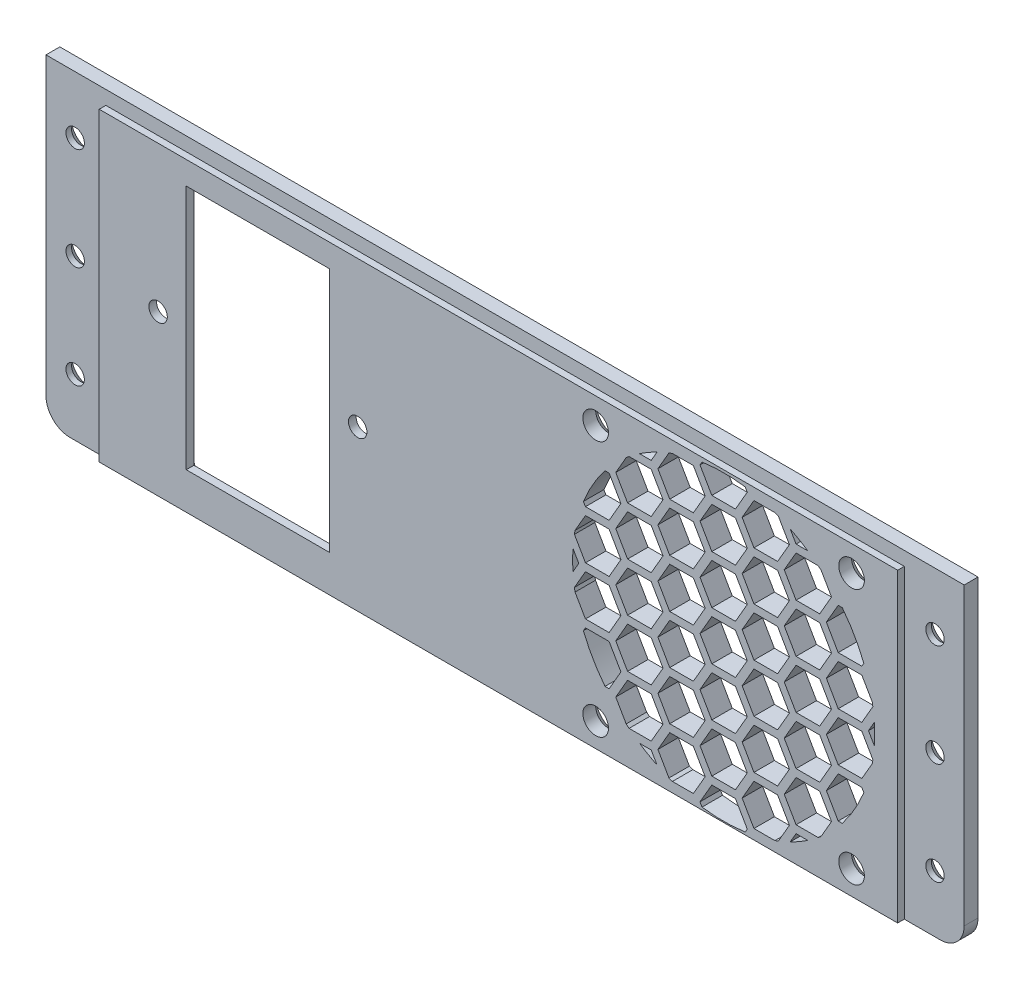
from build123d import *

# Parameters (mm, degrees)
SKETCH1_W                                       = 180
SKETCH1_H                                       = 63
BOSS_EXTRUDE1_DEPTH                             = 3
FILLET1_R                                       = 5
SKETCH2_W                                       = 156
SKETCH2_H                                       = 63
BOSS_EXTRUDE2_DEPTH                             = 4
CSK_FOR_M3_FLAT_HEAD_MACHINE_SCREW1_D           = 3.6
CSK_FOR_M3_FLAT_HEAD_MACHINE_SCREW1_DEPTH       = 8
CSK_FOR_M3_FLAT_HEAD_MACHINE_SCREW1_CSINK_D     = 6.8
CSK_FOR_M3_FLAT_HEAD_MACHINE_SCREW1_CSINK_ANGLE = 90
CSK_FOR_M3_FLAT_HEAD_MACHINE_SCREW1_TIP         = 1.081549114
SKETCH5_W                                       = 30
SKETCH5_H                                       = 60
CUT_EXTRUDE1_DEPTH                              = 2.5
SKETCH6_W                                       = 28
SKETCH6_H                                       = 48
CUT_EXTRUDE2_DEPTH                              = 96.45941546
FILLET2_R                                       = 2
M3_CLEARANCE_HOLE1_D                            = 3.6
M3_CLEARANCE_HOLE1_DEPTH                        = 8
M3_CLEARANCE_HOLE1_TIP                          = 1.081549114
CSK_FOR_M4_FLAT_HEAD_MACHINE_SCREW2_D           = 5
CSK_FOR_M4_FLAT_HEAD_MACHINE_SCREW2_CSINK_D     = 8
CSK_FOR_M4_FLAT_HEAD_MACHINE_SCREW2_CSINK_ANGLE = 90
SKETCH15_W                                      = 95
SKETCH15_H                                      = 63
CUT_EXTRUDE3_DEPTH                              = 3
SKETCH17_R                                      = 29.5
CUT_EXTRUDE7_DEPTH                              = 96.609884426
SKETCH18_W                                      = 180
SKETCH18_H                                      = 8
CUT_EXTRUDE8_DEPTH                              = 3
SKETCH20_W                                      = 30
SKETCH20_H                                      = 59
CUT_EXTRUDE9_DEPTH                              = 96.609884426
BOSS_EXTRUDE3_START                             = -4
BOSS_EXTRUDE3_DEPTH                             = 4
SKETCH20_2_W                                    = 30
SKETCH20_2_H                                    = 59
BOSS_EXTRUDE4_DEPTH                             = 4
SKETCH21_W                                      = 4
SKETCH21_H                                      = 60
CUT_EXTRUDE10_DEPTH                             = 3
SKETCH22_W                                      = 3
SKETCH22_H                                      = 60
CUT_EXTRUDE11_DEPTH                             = 116.595198862
CUT_EXTRUDE12_DEPTH                             = 0.3
CUT_EXTRUDE13_DEPTH                             = 96.437152095


# Read off the part's stored shape, not the designer's step: Boss-Extrude3
with BuildPart() as part:
    # Sketch1 → Boss-Extrude1 (new body)
    with BuildSketch(Plane.XY):
        Rectangle(SKETCH1_W, SKETCH1_H)
    extrude(amount=BOSS_EXTRUDE1_DEPTH)

    # Fillet1
    fillet1_edges = [part.edges().sort_by_distance(p)[0] for p in [
        (90, -31.5, 1.5),
        (-90, -31.5, 1.5),
    ]]
    fillet(fillet1_edges, radius=FILLET1_R)

    # Sketch2 → Boss-Extrude2 (add)
    with BuildSketch(Plane.XY.offset(3)):
        Rectangle(SKETCH2_W, SKETCH2_H)
    extrude(amount=BOSS_EXTRUDE2_DEPTH)

    # CSK for M3 Flat Head Machine Screw1
    with Locations(Plane(origin=(0, 0, 0), x_dir=(-1, 0, 0), z_dir=(0, 0, -1))):
        with Locations((-84, 20), (-84, -20), (84, 20), (84, -20), (-84, 0), (84, 0)):
            CounterSinkHole(CSK_FOR_M3_FLAT_HEAD_MACHINE_SCREW1_D / 2, CSK_FOR_M3_FLAT_HEAD_MACHINE_SCREW1_CSINK_D / 2, depth=CSK_FOR_M3_FLAT_HEAD_MACHINE_SCREW1_DEPTH, counter_sink_angle=CSK_FOR_M3_FLAT_HEAD_MACHINE_SCREW1_CSINK_ANGLE)
            with Locations((0, 0, -(CSK_FOR_M3_FLAT_HEAD_MACHINE_SCREW1_DEPTH + CSK_FOR_M3_FLAT_HEAD_MACHINE_SCREW1_TIP / 2))):  # 118° drill point
                Cone(0, CSK_FOR_M3_FLAT_HEAD_MACHINE_SCREW1_D / 2, CSK_FOR_M3_FLAT_HEAD_MACHINE_SCREW1_TIP, mode=Mode.SUBTRACT)

    # Sketch5 → Cut-Extrude1 (cut)
    with BuildSketch(Plane(origin=(0, 0, 0), x_dir=(-1, 0, 0), z_dir=(0, 0, -1))):
        Polygon((32, 30), (21, 0), (32, -30), align=None)
        with Locations((47, 0)):
            Rectangle(SKETCH5_W, SKETCH5_H)
        Polygon((62, -30), (73, 0), (62, 30), align=None)
    extrude(amount=-CUT_EXTRUDE1_DEPTH, mode=Mode.SUBTRACT)

    # Sketch6 → Cut-Extrude2 (cut, through all)
    with BuildSketch(Plane(origin=(0, 0, 2.5), x_dir=(-1, 0, 0), z_dir=(0, 0, -1))):
        with Locations((47, 0)):
            Rectangle(SKETCH6_W, SKETCH6_H)
    extrude(amount=-CUT_EXTRUDE2_DEPTH, mode=Mode.SUBTRACT)

    # Fillet2
    fillet2_edges = [part.edges().sort_by_distance(p)[0] for p in [
        (-21, 0, 1.25),
        (-32, 30, 1.25),
        (-62, 30, 1.25),
        (-73, 0, 1.25),
        (-62, -30, 1.25),
        (-32, -30, 1.25),
    ]]
    fillet(fillet2_edges, radius=FILLET2_R)

    # M3 Clearance Hole1
    with Locations(Plane(origin=(0, 0, 2.5), x_dir=(-1, 0, 0), z_dir=(0, 0, -1))):
        with Locations((27.5, 0), (66.5, 0)):
            Hole(M3_CLEARANCE_HOLE1_D / 2, depth=M3_CLEARANCE_HOLE1_DEPTH)
            with Locations((0, 0, -(M3_CLEARANCE_HOLE1_DEPTH + M3_CLEARANCE_HOLE1_TIP / 2))):  # 118° drill point
                Cone(0, M3_CLEARANCE_HOLE1_D / 2, M3_CLEARANCE_HOLE1_TIP, mode=Mode.SUBTRACT)

    # CSK for M4 Flat Head Machine Screw2 (through all)
    with Locations(Plane(origin=(0, 0, 0), x_dir=(-1, 0, 0), z_dir=(0, 0, -1))):
        with Locations((-19, 23.5), (-19, -26.5), (-69, -26.5), (-69, 23.5)):
            CounterSinkHole(CSK_FOR_M4_FLAT_HEAD_MACHINE_SCREW2_D / 2, CSK_FOR_M4_FLAT_HEAD_MACHINE_SCREW2_CSINK_D / 2, counter_sink_angle=CSK_FOR_M4_FLAT_HEAD_MACHINE_SCREW2_CSINK_ANGLE)

    # Sketch15 → Cut-Extrude3 (cut)
    with BuildSketch(Plane.XY.offset(7)):
        with Locations((26.5, 0)):
            Rectangle(SKETCH15_W, SKETCH15_H)
    extrude(amount=-CUT_EXTRUDE3_DEPTH, mode=Mode.SUBTRACT)

    # Sketch17 → Cut-Extrude7 (cut, through all)
    with BuildSketch(Plane(origin=(0, 0, 0), x_dir=(-1, 0, 0), z_dir=(0, 0, -1))):
        with Locations((-44, -1.5)):
            Circle(SKETCH17_R)
    extrude(amount=-CUT_EXTRUDE7_DEPTH, mode=Mode.SUBTRACT)

    # Sketch18 → Cut-Extrude8 (cut)
    with BuildSketch(Plane(origin=(0, 31.5, 0), x_dir=(1, 0, 0), z_dir=(0, 1, 0))):
        with Locations((0, -7)):
            Rectangle(SKETCH18_W, SKETCH18_H)
    extrude(amount=-CUT_EXTRUDE8_DEPTH, mode=Mode.SUBTRACT)

    # Sketch20 → Cut-Extrude9 (cut, through all)
    with BuildSketch(Plane(origin=(0, 0, 0), x_dir=(-1, 0, 0), z_dir=(0, 0, -1))):
        with Locations((5, -1.5)):
            Rectangle(SKETCH20_W, SKETCH20_H)
    extrude(amount=-CUT_EXTRUDE9_DEPTH, mode=Mode.SUBTRACT)

    # Boss-Extrude3 outline → Boss-Extrude3 (add)
    # profile 1 of 2: a face of its own
    with BuildSketch(Plane(origin=(0, 0, 0), x_dir=(-1, 0, 0), z_dir=(0, 0, -1)).offset(BOSS_EXTRUDE3_START)):
        Polygon((-10, 2.5), (-8.770598923, 2.5), (-6.461197846, -1.5), (-8.770598923, -5.5), (-10, -5.5), (-10, -7), (-8.770598923, -7), (-6.461197846, -11), (-8.770598923, -15), (-10, -15), (-10, -16.5), (-8.770598923, -16.5), (-6.461197846, -20.5), (-8.770598923, -24.5), (-10, -24.5), (-10, -26), (-8.770598923, -26), (-6.461197846, -30), (-7.038548116, -31), (1.338548116, -31), (0.761197846, -30), (3.070598923, -26), (7.689401077, -26), (9.998802154, -30), (9.421451884, -31), (17.798548116, -31), (17.221197846, -30), (19.530598923, -26), (20, -26), (20, -24.5), (19.530598923, -24.5), (17.221197846, -20.5), (19.530598923, -16.5), (20, -16.5), (20, -15), (19.530598923, -15), (17.221197846, -11), (19.530598923, -7), (20, -7), (20, -5.5), (19.530598923, -5.5), (17.221197846, -1.5), (19.530598923, 2.5), (20, 2.5), (20, 4), (19.530598923, 4), (17.221197846, 8), (19.530598923, 12), (20, 12), (20, 13.5), (19.530598923, 13.5), (17.221197846, 17.5), (19.530598923, 21.5), (20, 21.5), (20, 23), (19.530598923, 23), (17.221197846, 27), (17.798548116, 28), (9.421451884, 28), (9.998802154, 27), (7.689401077, 23), (3.070598923, 23), (0.761197846, 27), (1.338548116, 28), (-7.038548116, 28), (-6.461197846, 27), (-8.770598923, 23), (-10, 23), (-10, 21.5), (-8.770598923, 21.5), (-6.461197846, 17.5), (-8.770598923, 13.5), (-10, 13.5), (-10, 12), (-8.770598923, 12), (-6.461197846, 8), (-8.770598923, 4), (-10, 4), align=None)
        Polygon((-5.162159741, -21.25), (-0.543357587, -21.25), (1.766043489, -25.25), (-0.543357587, -29.25), (-5.162159741, -29.25), (-7.471560818, -25.25), align=None, mode=Mode.SUBTRACT)
        Polygon((11.297840259, -21.25), (15.916642413, -21.25), (18.226043489, -25.25), (15.916642413, -29.25), (11.297840259, -29.25), (8.988439182, -25.25), align=None, mode=Mode.SUBTRACT)
        Polygon((3.070598923, -16.5), (7.689401077, -16.5), (9.998802154, -20.5), (7.689401077, -24.5), (3.070598923, -24.5), (0.761197846, -20.5), align=None, mode=Mode.SUBTRACT)
        Polygon((-5.162159741, -11.75), (-0.543357587, -11.75), (1.766043489, -15.75), (-0.543357587, -19.75), (-5.162159741, -19.75), (-7.471560818, -15.75), align=None, mode=Mode.SUBTRACT)
        Polygon((3.070598923, -7), (7.689401077, -7), (9.998802154, -11), (7.689401077, -15), (3.070598923, -15), (0.761197846, -11), align=None, mode=Mode.SUBTRACT)
        Polygon((11.297840259, -11.75), (15.916642413, -11.75), (18.226043489, -15.75), (15.916642413, -19.75), (11.297840259, -19.75), (8.988439182, -15.75), align=None, mode=Mode.SUBTRACT)
        Polygon((-5.162159741, -2.25), (-0.543357587, -2.25), (1.766043489, -6.25), (-0.543357587, -10.25), (-5.162159741, -10.25), (-7.471560818, -6.25), align=None, mode=Mode.SUBTRACT)
        Polygon((11.297840259, -2.25), (15.916642413, -2.25), (18.226043489, -6.25), (15.916642413, -10.25), (11.297840259, -10.25), (8.988439182, -6.25), align=None, mode=Mode.SUBTRACT)
        Polygon((3.070598923, 2.5), (7.689401077, 2.5), (9.998802154, -1.5), (7.689401077, -5.5), (3.070598923, -5.5), (0.761197846, -1.5), align=None, mode=Mode.SUBTRACT)
        Polygon((-5.162159741, 7.25), (-0.543357587, 7.25), (1.766043489, 3.25), (-0.543357587, -0.75), (-5.162159741, -0.75), (-7.471560818, 3.25), align=None, mode=Mode.SUBTRACT)
        Polygon((11.297840259, 7.25), (15.916642413, 7.25), (18.226043489, 3.25), (15.916642413, -0.75), (11.297840259, -0.75), (8.988439182, 3.25), align=None, mode=Mode.SUBTRACT)
        Polygon((3.070598923, 12), (7.689401077, 12), (9.998802154, 8), (7.689401077, 4), (3.070598923, 4), (0.761197846, 8), align=None, mode=Mode.SUBTRACT)
        Polygon((-5.162159741, 16.75), (-0.543357587, 16.75), (1.766043489, 12.75), (-0.543357587, 8.75), (-5.162159741, 8.75), (-7.471560818, 12.75), align=None, mode=Mode.SUBTRACT)
        Polygon((11.297840259, 16.75), (15.916642413, 16.75), (18.226043489, 12.75), (15.916642413, 8.75), (11.297840259, 8.75), (8.988439182, 12.75), align=None, mode=Mode.SUBTRACT)
        Polygon((3.070598923, 21.5), (7.689401077, 21.5), (9.998802154, 17.5), (7.689401077, 13.5), (3.070598923, 13.5), (0.761197846, 17.5), align=None, mode=Mode.SUBTRACT)
        Polygon((-0.543357587, 18.25), (-5.162159741, 18.25), (-7.471560818, 22.25), (-5.162159741, 26.25), (-0.543357587, 26.25), (1.766043489, 22.25), align=None, mode=Mode.SUBTRACT)
        Polygon((15.916642413, 18.25), (11.297840259, 18.25), (8.988439182, 22.25), (11.297840259, 26.25), (15.916642413, 26.25), (18.226043489, 22.25), align=None, mode=Mode.SUBTRACT)
    # profile 2 of 2: a face of its own
    with BuildSketch(Plane(origin=(0, 0, 0), x_dir=(-1, 0, 0), z_dir=(0, 0, -1)).offset(BOSS_EXTRUDE3_START)):
        with BuildLine():
            Line((-71.002159741, 7.25), (-66.383357587, 7.25))
            Line((-66.383357587, 7.25), (-64.073956511, 3.25))
            Line((-64.073956511, 3.25), (-66.383357587, -0.75))
            Line((-66.383357587, -0.75), (-71.002159741, -0.75))
            Line((-71.002159741, -0.75), (-73.157384631, 2.982959011))
            ThreePointArc((-73.157384631, 2.982959011), (-73.323076078, 1.726020663), (-73.434607942, 0.46312387))
            Line((-73.434607942, 0.46312387), (-72.301197846, -1.5))
            Line((-72.301197846, -1.5), (-73.434607942, -3.46312387))
            ThreePointArc((-73.434607942, -3.46312387), (-73.323076078, -4.726020663), (-73.157384631, -5.982959011))
            Line((-73.157384631, -5.982959011), (-71.002159741, -2.25))
            Line((-71.002159741, -2.25), (-66.383357587, -2.25))
            Line((-66.383357587, -2.25), (-64.073956511, -6.25))
            Line((-64.073956511, -6.25), (-66.383357587, -10.25))
            Line((-66.383357587, -10.25), (-71.002159741, -10.25))
            Line((-71.002159741, -10.25), (-73.031899444, -6.734387708))
            ThreePointArc((-73.031899444, -6.734387708), (-72.358660898, -9.626275411), (-71.398128519, -12.435838042))
            Line((-71.398128519, -12.435838042), (-71.002159741, -11.75))
            Line((-71.002159741, -11.75), (-66.383357587, -11.75))
            Line((-66.383357587, -11.75), (-64.073956511, -15.75))
            Line((-64.073956511, -15.75), (-66.383357587, -19.75))
            Line((-66.383357587, -19.75), (-67.177305711, -19.75))
            ThreePointArc((-67.177305711, -19.75), (-65.216215637, -21.996882544), (-63.038286077, -24.034277517))
            Line((-63.038286077, -24.034277517), (-65.078802154, -20.5))
            Line((-65.078802154, -20.5), (-62.769401077, -16.5))
            Line((-62.769401077, -16.5), (-58.150598923, -16.5))
            Line((-58.150598923, -16.5), (-55.841197846, -20.5))
            Line((-55.841197846, -20.5), (-58.150598923, -24.5))
            Line((-58.150598923, -24.5), (-62.472953202, -24.5))
            ThreePointArc((-62.472953202, -24.5), (-61.468422871, -25.271920461), (-60.431676725, -26))
            Line((-60.431676725, -26), (-58.150598923, -26))
            Line((-58.150598923, -26), (-57.009485308, -27.976466759))
            ThreePointArc((-57.009485308, -27.976466759), (-55.860297918, -28.510800308), (-54.689221018, -28.995282396))
            Line((-54.689221018, -28.995282396), (-56.851560818, -25.25))
            Line((-56.851560818, -25.25), (-54.542159741, -21.25))
            Line((-54.542159741, -21.25), (-49.923357587, -21.25))
            Line((-49.923357587, -21.25), (-47.613956511, -25.25))
            Line((-47.613956511, -25.25), (-49.923357587, -29.25))
            Line((-49.923357587, -29.25), (-54.00937061, -29.25))
            ThreePointArc((-54.00937061, -29.25), (-51.149549143, -30.120516191), (-48.216310764, -30.697135537))
            Line((-48.216310764, -30.697135537), (-48.618802154, -30))
            Line((-48.618802154, -30), (-46.309401077, -26))
            Line((-46.309401077, -26), (-41.690598923, -26))
            Line((-41.690598923, -26), (-39.381197846, -30))
            Line((-39.381197846, -30), (-39.783689236, -30.697135537))
            ThreePointArc((-39.783689236, -30.697135537), (-36.850450857, -30.120516191), (-33.99062939, -29.25))
            Line((-33.99062939, -29.25), (-38.082159741, -29.25))
            Line((-38.082159741, -29.25), (-40.391560818, -25.25))
            Line((-40.391560818, -25.25), (-38.082159741, -21.25))
            Line((-38.082159741, -21.25), (-33.463357587, -21.25))
            Line((-33.463357587, -21.25), (-31.153956511, -25.25))
            Line((-31.153956511, -25.25), (-33.317892314, -28.998046756))
            ThreePointArc((-33.317892314, -28.998046756), (-32.143196001, -28.5123342), (-30.990514692, -27.976466759))
            Line((-30.990514692, -27.976466759), (-29.849401077, -26))
            Line((-29.849401077, -26), (-27.568323275, -26))
            ThreePointArc((-27.568323275, -26), (-26.531577129, -25.271920461), (-25.527046798, -24.5))
            Line((-25.527046798, -24.5), (-29.849401077, -24.5))
            Line((-29.849401077, -24.5), (-32.158802154, -20.5))
            Line((-32.158802154, -20.5), (-29.849401077, -16.5))
            Line((-29.849401077, -16.5), (-25.230598923, -16.5))
            Line((-25.230598923, -16.5), (-22.921197846, -20.5))
            Line((-22.921197846, -20.5), (-24.961713923, -24.034277517))
            ThreePointArc((-24.961713923, -24.034277517), (-22.783784363, -21.996882544), (-20.822694289, -19.75))
            Line((-20.822694289, -19.75), (-21.622159741, -19.75))
            Line((-21.622159741, -19.75), (-23.931560818, -15.75))
            Line((-23.931560818, -15.75), (-21.622159741, -11.75))
            Line((-21.622159741, -11.75), (-17.003357587, -11.75))
            Line((-17.003357587, -11.75), (-16.604127104, -12.44148748))
            ThreePointArc((-16.604127104, -12.44148748), (-15.640233737, -9.622416976), (-14.965600175, -6.720500629))
            Line((-14.965600175, -6.720500629), (-17.003357587, -10.25))
            Line((-17.003357587, -10.25), (-21.622159741, -10.25))
            Line((-21.622159741, -10.25), (-23.931560818, -6.25))
            Line((-23.931560818, -6.25), (-21.622159741, -2.25))
            Line((-21.622159741, -2.25), (-17.003357587, -2.25))
            Line((-17.003357587, -2.25), (-14.843776452, -5.99050425))
            ThreePointArc((-14.843776452, -5.99050425), (-14.677341584, -4.72981477), (-14.565392058, -3.46312387))
            Line((-14.565392058, -3.46312387), (-15.698802154, -1.5))
            Line((-15.698802154, -1.5), (-14.565392058, 0.46312387))
            ThreePointArc((-14.565392058, 0.46312387), (-14.677341584, 1.72981477), (-14.843776452, 2.99050425))
            Line((-14.843776452, 2.99050425), (-17.003357587, -0.75))
            Line((-17.003357587, -0.75), (-21.622159741, -0.75))
            Line((-21.622159741, -0.75), (-23.931560818, 3.25))
            Line((-23.931560818, 3.25), (-21.622159741, 7.25))
            Line((-21.622159741, 7.25), (-17.003357587, 7.25))
            Line((-17.003357587, 7.25), (-14.965600175, 3.720500629))
            ThreePointArc((-14.965600175, 3.720500629), (-15.640233737, 6.622416976), (-16.604127104, 9.44148748))
            Line((-16.604127104, 9.44148748), (-17.003357587, 8.75))
            Line((-17.003357587, 8.75), (-21.622159741, 8.75))
            Line((-21.622159741, 8.75), (-23.931560818, 12.75))
            Line((-23.931560818, 12.75), (-21.622159741, 16.75))
            Line((-21.622159741, 16.75), (-20.822694289, 16.75))
            ThreePointArc((-20.822694289, 16.75), (-22.783784363, 18.996882544), (-24.961713923, 21.034277517))
            Line((-24.961713923, 21.034277517), (-22.921197846, 17.5))
            Line((-22.921197846, 17.5), (-25.230598923, 13.5))
            Line((-25.230598923, 13.5), (-29.849401077, 13.5))
            Line((-29.849401077, 13.5), (-32.158802154, 17.5))
            Line((-32.158802154, 17.5), (-29.849401077, 21.5))
            Line((-29.849401077, 21.5), (-25.527046798, 21.5))
            ThreePointArc((-25.527046798, 21.5), (-26.531577129, 22.271920461), (-27.568323275, 23))
            Line((-27.568323275, 23), (-29.849401077, 23))
            Line((-29.849401077, 23), (-30.990514692, 24.976466759))
            ThreePointArc((-30.990514692, 24.976466759), (-32.143196001, 25.5123342), (-33.317892314, 25.998046756))
            Line((-33.317892314, 25.998046756), (-31.153956511, 22.25))
            Line((-31.153956511, 22.25), (-33.463357587, 18.25))
            Line((-33.463357587, 18.25), (-38.082159741, 18.25))
            Line((-38.082159741, 18.25), (-40.391560818, 22.25))
            Line((-40.391560818, 22.25), (-38.082159741, 26.25))
            Line((-38.082159741, 26.25), (-33.99062939, 26.25))
            ThreePointArc((-33.99062939, 26.25), (-36.850450857, 27.120516191), (-39.783689236, 27.697135537))
            Line((-39.783689236, 27.697135537), (-39.381197846, 27))
            Line((-39.381197846, 27), (-41.690598923, 23))
            Line((-41.690598923, 23), (-46.309401077, 23))
            Line((-46.309401077, 23), (-48.618802154, 27))
            Line((-48.618802154, 27), (-48.216310764, 27.697135537))
            ThreePointArc((-48.216310764, 27.697135537), (-51.149549143, 27.120516191), (-54.00937061, 26.25))
            Line((-54.00937061, 26.25), (-49.923357587, 26.25))
            Line((-49.923357587, 26.25), (-47.613956511, 22.25))
            Line((-47.613956511, 22.25), (-49.923357587, 18.25))
            Line((-49.923357587, 18.25), (-54.542159741, 18.25))
            Line((-54.542159741, 18.25), (-56.851560818, 22.25))
            Line((-56.851560818, 22.25), (-54.689221018, 25.995282396))
            ThreePointArc((-54.689221018, 25.995282396), (-55.860297918, 25.510800308), (-57.009485308, 24.976466759))
            Line((-57.009485308, 24.976466759), (-58.150598923, 23))
            Line((-58.150598923, 23), (-60.431676725, 23))
            ThreePointArc((-60.431676725, 23), (-61.468422871, 22.271920461), (-62.472953202, 21.5))
            Line((-62.472953202, 21.5), (-58.150598923, 21.5))
            Line((-58.150598923, 21.5), (-55.841197846, 17.5))
            Line((-55.841197846, 17.5), (-58.150598923, 13.5))
            Line((-58.150598923, 13.5), (-62.769401077, 13.5))
            Line((-62.769401077, 13.5), (-65.078802154, 17.5))
            Line((-65.078802154, 17.5), (-63.038286077, 21.034277517))
            ThreePointArc((-63.038286077, 21.034277517), (-65.216215637, 18.996882544), (-67.177305711, 16.75))
            Line((-67.177305711, 16.75), (-66.383357587, 16.75))
            Line((-66.383357587, 16.75), (-64.073956511, 12.75))
            Line((-64.073956511, 12.75), (-66.383357587, 8.75))
            Line((-66.383357587, 8.75), (-71.002159741, 8.75))
            Line((-71.002159741, 8.75), (-71.398128519, 9.435838042))
            ThreePointArc((-71.398128519, 9.435838042), (-72.358660898, 6.626275411), (-73.031899444, 3.734387708))
            Line((-73.031899444, 3.734387708), (-71.002159741, 7.25))
        make_face()
        Polygon((-39.381197846, -20.5), (-41.690598923, -24.5), (-46.309401077, -24.5), (-48.618802154, -20.5), (-46.309401077, -16.5), (-41.690598923, -16.5), align=None, mode=Mode.SUBTRACT)
        Polygon((-54.542159741, -11.75), (-49.923357587, -11.75), (-47.613956511, -15.75), (-49.923357587, -19.75), (-54.542159741, -19.75), (-56.851560818, -15.75), align=None, mode=Mode.SUBTRACT)
        Polygon((-62.769401077, -7), (-58.150598923, -7), (-55.841197846, -11), (-58.150598923, -15), (-62.769401077, -15), (-65.078802154, -11), align=None, mode=Mode.SUBTRACT)
        Polygon((-54.542159741, -2.25), (-49.923357587, -2.25), (-47.613956511, -6.25), (-49.923357587, -10.25), (-54.542159741, -10.25), (-56.851560818, -6.25), align=None, mode=Mode.SUBTRACT)
        Polygon((-39.381197846, -11), (-41.690598923, -15), (-46.309401077, -15), (-48.618802154, -11), (-46.309401077, -7), (-41.690598923, -7), align=None, mode=Mode.SUBTRACT)
        Polygon((-33.463357587, -11.75), (-31.153956511, -15.75), (-33.463357587, -19.75), (-38.082159741, -19.75), (-40.391560818, -15.75), (-38.082159741, -11.75), align=None, mode=Mode.SUBTRACT)
        Polygon((-29.849401077, -7), (-25.230598923, -7), (-22.921197846, -11), (-25.230598923, -15), (-29.849401077, -15), (-32.158802154, -11), align=None, mode=Mode.SUBTRACT)
        Polygon((-31.153956511, -6.25), (-33.463357587, -10.25), (-38.082159741, -10.25), (-40.391560818, -6.25), (-38.082159741, -2.25), (-33.463357587, -2.25), align=None, mode=Mode.SUBTRACT)
        Polygon((-62.769401077, 2.5), (-58.150598923, 2.5), (-55.841197846, -1.5), (-58.150598923, -5.5), (-62.769401077, -5.5), (-65.078802154, -1.5), align=None, mode=Mode.SUBTRACT)
        Polygon((-54.542159741, 7.25), (-49.923357587, 7.25), (-47.613956511, 3.25), (-49.923357587, -0.75), (-54.542159741, -0.75), (-56.851560818, 3.25), align=None, mode=Mode.SUBTRACT)
        Polygon((-62.769401077, 12), (-58.150598923, 12), (-55.841197846, 8), (-58.150598923, 4), (-62.769401077, 4), (-65.078802154, 8), align=None, mode=Mode.SUBTRACT)
        Polygon((-54.542159741, 16.75), (-49.923357587, 16.75), (-47.613956511, 12.75), (-49.923357587, 8.75), (-54.542159741, 8.75), (-56.851560818, 12.75), align=None, mode=Mode.SUBTRACT)
        Polygon((-39.381197846, -1.5), (-41.690598923, -5.5), (-46.309401077, -5.5), (-48.618802154, -1.5), (-46.309401077, 2.5), (-41.690598923, 2.5), align=None, mode=Mode.SUBTRACT)
        Polygon((-29.849401077, 2.5), (-25.230598923, 2.5), (-22.921197846, -1.5), (-25.230598923, -5.5), (-29.849401077, -5.5), (-32.158802154, -1.5), align=None, mode=Mode.SUBTRACT)
        Polygon((-31.153956511, 3.25), (-33.463357587, -0.75), (-38.082159741, -0.75), (-40.391560818, 3.25), (-38.082159741, 7.25), (-33.463357587, 7.25), align=None, mode=Mode.SUBTRACT)
        Polygon((-41.690598923, 12), (-39.381197846, 8), (-41.690598923, 4), (-46.309401077, 4), (-48.618802154, 8), (-46.309401077, 12), align=None, mode=Mode.SUBTRACT)
        Polygon((-29.849401077, 12), (-25.230598923, 12), (-22.921197846, 8), (-25.230598923, 4), (-29.849401077, 4), (-32.158802154, 8), align=None, mode=Mode.SUBTRACT)
        Polygon((-31.153956511, 12.75), (-33.463357587, 8.75), (-38.082159741, 8.75), (-40.391560818, 12.75), (-38.082159741, 16.75), (-33.463357587, 16.75), align=None, mode=Mode.SUBTRACT)
        Polygon((-41.690598923, 21.5), (-39.381197846, 17.5), (-41.690598923, 13.5), (-46.309401077, 13.5), (-48.618802154, 17.5), (-46.309401077, 21.5), align=None, mode=Mode.SUBTRACT)
    extrude(amount=BOSS_EXTRUDE3_DEPTH)

    # Sketch20<2> → Boss-Extrude4 (add)
    with BuildSketch(Plane(origin=(0, 0, 0), x_dir=(-1, 0, 0), z_dir=(0, 0, -1))):
        with Locations((5, -1.5)):
            Rectangle(SKETCH20_2_W, SKETCH20_2_H)
    extrude(amount=-BOSS_EXTRUDE4_DEPTH)

    # Sketch21 → Cut-Extrude10 (cut)
    with BuildSketch(Plane.XY.offset(7)):
        with Locations((76, -1.5)):
            Rectangle(SKETCH21_W, SKETCH21_H)
    extrude(amount=-CUT_EXTRUDE10_DEPTH, mode=Mode.SUBTRACT)

    # Sketch22 → Cut-Extrude11 (cut, through all)
    with BuildSketch(Plane(origin=(-21, 0, 0), x_dir=(0, 0, -1), z_dir=(1, 0, 0))):
        with Locations((-5.5, -1.5)):
            Rectangle(SKETCH22_W, SKETCH22_H)
    extrude(amount=-CUT_EXTRUDE11_DEPTH, mode=Mode.SUBTRACT)

    # Sketch23 → Cut-Extrude12 (cut)
    with BuildSketch(Plane.XY.offset(3)):
        with BuildLine():
            Line((90, 31.5), (-90, 31.5))
            Line((-90, 31.5), (-90, -26.5))
            ThreePointArc((-90, -26.5), (-88.535533906, -30.035533906), (-85, -31.5))
            Line((-85, -31.5), (-78, -31.5))
            Line((-78, -31.5), (-78, 28.5))
            Line((-78, 28.5), (78, 28.5))
            Line((78, 28.5), (78, -31.5))
            Line((78, -31.5), (85, -31.5))
            ThreePointArc((85, -31.5), (88.535533906, -30.035533906), (90, -26.5))
            Line((90, -26.5), (90, 31.5))
        make_face()
    extrude(amount=-CUT_EXTRUDE12_DEPTH, mode=Mode.SUBTRACT)

    # Sketch24 → Cut-Extrude13 (cut, through all)
    with BuildSketch(Plane(origin=(0, 0, 0), x_dir=(-1, 0, 0), z_dir=(0, 0, -1))):
        with BuildLine():
            Line((90, 31.5), (90, -26.5))
            ThreePointArc((90, -26.5), (88.535533906, -30.035533906), (85, -31.5))
            Line((85, -31.5), (-85, -31.5))
            ThreePointArc((-85, -31.5), (-88.535533906, -30.035533906), (-90, -26.5))
            Line((-90, -26.5), (-90, 31.5))
            Line((-90, 31.5), (90, 31.5))
        make_face()
        with BuildLine():
            Line((-85, -31.2), (85, -31.2))
            ThreePointArc((85, -31.2), (88.323401872, -29.823401872), (89.7, -26.5))
            Line((89.7, -26.5), (89.7, 31.2))
            Line((89.7, 31.2), (-89.7, 31.2))
            Line((-89.7, 31.2), (-89.7, -26.5))
            ThreePointArc((-89.7, -26.5), (-88.323401872, -29.823401872), (-85, -31.2))
        make_face(mode=Mode.SUBTRACT)
    extrude(amount=-CUT_EXTRUDE13_DEPTH, mode=Mode.SUBTRACT)


solid = part.part
